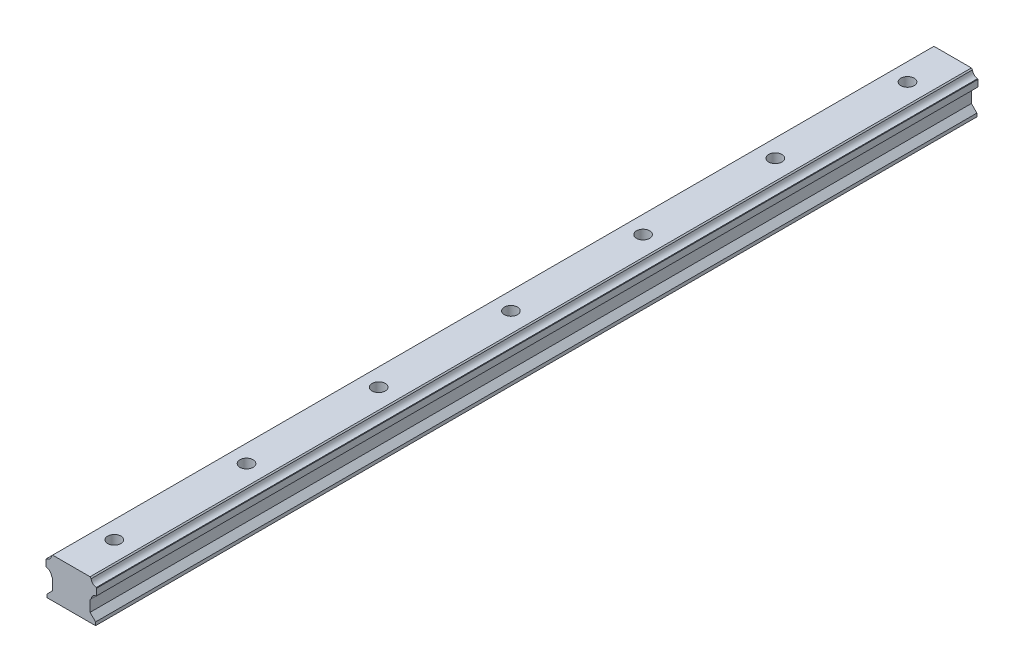
from build123d import *

# Parameters (mm, degrees)
ESTRUSIONE_ESTRUSIONE1_DEPTH      = 400
SCHIZZO2_R                        = 3
TAGLIO_ESTRUSIONE1_DEPTH          = 401.599824902
RIPETIZIONE_A_L1_COUNT            = 4
RIPETIZIONE_A_L1_PITCH            = 60
RIPETIZIONE_A_L2_COPY_1_SKETCH_R  = 3
RIPETIZIONE_A_L2_COPY_1_DEPTH     = 401.599824902
RIPETIZIONE_A_L2_COPY_2_SKETCH_R  = 3
RIPETIZIONE_A_L2_COPY_2_DEPTH     = 401.599824902
RIPETIZIONE_A_L2_COPY_3_SKETCH_R  = 3
RIPETIZIONE_A_L2_COPY_3_DEPTH     = 401.599824902
RIPETIZIONE_A_L2_COPY_4_SKETCH_R  = 3
RIPETIZIONE_A_L2_COPY_4_DEPTH     = 401.599824902
RIPETIZIONE_A_L2_COPY_5_SKETCH_R  = 3
RIPETIZIONE_A_L2_COPY_5_DEPTH     = 401.599824902
RIPETIZIONE_A_L2_COPY_6_SKETCH_R  = 3
RIPETIZIONE_A_L2_COPY_6_DEPTH     = 401.599824902
RIPETIZIONE_A_L2_COPY_7_SKETCH_R  = 3
RIPETIZIONE_A_L2_COPY_7_DEPTH     = 401.599824902
RIPETIZIONE_A_L2_COPY_8_SKETCH_R  = 3
RIPETIZIONE_A_L2_COPY_8_DEPTH     = 401.599824902
RIPETIZIONE_A_L2_COPY_9_SKETCH_R  = 3
RIPETIZIONE_A_L2_COPY_9_DEPTH     = 401.599824902
RIPETIZIONE_A_L2_COPY_10_SKETCH_R = 3
RIPETIZIONE_A_L2_COPY_10_DEPTH    = 401.599824902
RIPETIZIONE_A_L2_COPY_11_SKETCH_R = 3
RIPETIZIONE_A_L2_COPY_11_DEPTH    = 401.599824902
RIPETIZIONE_A_L2_COPY_12_SKETCH_R = 3
RIPETIZIONE_A_L2_COPY_12_DEPTH    = 401.599824902


with BuildPart() as part:
    # Schizzo1 → Estrusione-Estrusione1 (new body)
    with BuildSketch(Plane.XY):
        with BuildLine():
            Line((-10.001211602, -16.276222172), (-7.501211602, -13.776222172))
            Line((-7.501211602, -13.776222172), (-7.501211602, -8.776222172))
            Line((-7.501211602, -8.776222172), (-8.008796188, -8.268637585))
            ThreePointArc((-8.008796188, -8.268637585), (-8.733444649, -6.695460987), (-10.306621247, -5.970812526))
            Line((-10.306621247, -5.970812526), (-10.501211602, -5.776222172))
            Line((-10.501211602, -5.776222172), (-10.501211602, -2.776222172))
            Line((-10.501211602, -2.776222172), (-10.306621247, -2.581631817))
            ThreePointArc((-10.306621247, -2.581631817), (-8.733444649, -1.856983356), (-8.008796188, -0.283806758))
            Line((-8.008796188, -0.283806758), (-7.501211602, 0.223777828))
            Line((-7.501211602, 0.223777828), (9.498788398, 0.223777828))
            Line((9.498788398, 0.223777828), (10.006372984, -0.283806758))
            ThreePointArc((10.006372984, -0.283806758), (10.731021445, -1.856983356), (12.304198043, -2.581631817))
            Line((12.304198043, -2.581631817), (12.498788398, -2.776222172))
            Line((12.498788398, -2.776222172), (12.498788398, -5.776222172))
            Line((12.498788398, -5.776222172), (12.304198043, -5.970812526))
            ThreePointArc((12.304198043, -5.970812526), (10.731021445, -6.695460987), (10.006372984, -8.268637585))
            Line((10.006372984, -8.268637585), (9.498788398, -8.776222172))
            Line((9.498788398, -8.776222172), (9.498788398, -13.776222172))
            Line((9.498788398, -13.776222172), (11.998788398, -16.276222172))
            Line((11.998788398, -16.276222172), (11.998788398, -17.776222172))
            Line((11.998788398, -17.776222172), (-10.001211602, -17.776222172))
            Line((-10.001211602, -17.776222172), (-10.001211602, -16.276222172))
        make_face()
    extrude(amount=ESTRUSIONE_ESTRUSIONE1_DEPTH)

    # Schizzo2 → Taglio-Estrusione1 (cut, through all)
    with BuildSketch(Plane(origin=(0, 0.223777828, 0), x_dir=(1, 0, 0), z_dir=(0, 1, 0))):
        with Locations((0.499394199, -200)):
            Circle(SCHIZZO2_R)
    taglio_estrusione1 = extrude(amount=-TAGLIO_ESTRUSIONE1_DEPTH, mode=Mode.SUBTRACT)

    # Ripetizione a L1: Taglio-Estrusione1 ×4
    with Locations(*[(0, 0, i * RIPETIZIONE_A_L1_PITCH) for i in range(1, RIPETIZIONE_A_L1_COUNT)]):
        add(taglio_estrusione1, mode=Mode.SUBTRACT)

    # Ripetizione a L2 copy 1 sketch → Ripetizione a L2 copy 1 (cut, through all)
    with BuildSketch(Plane(origin=(0, 0.223777828, 0), x_dir=(1, 0, 0), z_dir=(0, 1, 0))):
        with Locations((0.499394199, -200)):
            Circle(RIPETIZIONE_A_L2_COPY_1_SKETCH_R)
    extrude(amount=-RIPETIZIONE_A_L2_COPY_1_DEPTH, mode=Mode.SUBTRACT)

    # Ripetizione a L2 copy 2 sketch → Ripetizione a L2 copy 2 (cut, through all)
    with BuildSketch(Plane(origin=(0, 0.223777828, -60), x_dir=(1, 0, 0), z_dir=(0, 1, 0))):
        with Locations((0.499394199, -200)):
            Circle(RIPETIZIONE_A_L2_COPY_2_SKETCH_R)
    extrude(amount=-RIPETIZIONE_A_L2_COPY_2_DEPTH, mode=Mode.SUBTRACT)

    # Ripetizione a L2 copy 3 sketch → Ripetizione a L2 copy 3 (cut, through all)
    with BuildSketch(Plane(origin=(0, 0.223777828, -120), x_dir=(1, 0, 0), z_dir=(0, 1, 0))):
        with Locations((0.499394199, -200)):
            Circle(RIPETIZIONE_A_L2_COPY_3_SKETCH_R)
    extrude(amount=-RIPETIZIONE_A_L2_COPY_3_DEPTH, mode=Mode.SUBTRACT)

    # Ripetizione a L2 copy 4 sketch → Ripetizione a L2 copy 4 (cut, through all)
    with BuildSketch(Plane(origin=(0, 0.223777828, 60), x_dir=(1, 0, 0), z_dir=(0, 1, 0))):
        with Locations((0.499394199, -200)):
            Circle(RIPETIZIONE_A_L2_COPY_4_SKETCH_R)
    extrude(amount=-RIPETIZIONE_A_L2_COPY_4_DEPTH, mode=Mode.SUBTRACT)

    # Ripetizione a L2 copy 5 sketch → Ripetizione a L2 copy 5 (cut, through all)
    with BuildSketch(Plane(origin=(0, 0.223777828, 0), x_dir=(1, 0, 0), z_dir=(0, 1, 0))):
        with Locations((0.499394199, -200)):
            Circle(RIPETIZIONE_A_L2_COPY_5_SKETCH_R)
    extrude(amount=-RIPETIZIONE_A_L2_COPY_5_DEPTH, mode=Mode.SUBTRACT)

    # Ripetizione a L2 copy 6 sketch → Ripetizione a L2 copy 6 (cut, through all)
    with BuildSketch(Plane(origin=(0, 0.223777828, -60), x_dir=(1, 0, 0), z_dir=(0, 1, 0))):
        with Locations((0.499394199, -200)):
            Circle(RIPETIZIONE_A_L2_COPY_6_SKETCH_R)
    extrude(amount=-RIPETIZIONE_A_L2_COPY_6_DEPTH, mode=Mode.SUBTRACT)

    # Ripetizione a L2 copy 7 sketch → Ripetizione a L2 copy 7 (cut, through all)
    with BuildSketch(Plane(origin=(0, 0.223777828, 120), x_dir=(1, 0, 0), z_dir=(0, 1, 0))):
        with Locations((0.499394199, -200)):
            Circle(RIPETIZIONE_A_L2_COPY_7_SKETCH_R)
    extrude(amount=-RIPETIZIONE_A_L2_COPY_7_DEPTH, mode=Mode.SUBTRACT)

    # Ripetizione a L2 copy 8 sketch → Ripetizione a L2 copy 8 (cut, through all)
    with BuildSketch(Plane(origin=(0, 0.223777828, 60), x_dir=(1, 0, 0), z_dir=(0, 1, 0))):
        with Locations((0.499394199, -200)):
            Circle(RIPETIZIONE_A_L2_COPY_8_SKETCH_R)
    extrude(amount=-RIPETIZIONE_A_L2_COPY_8_DEPTH, mode=Mode.SUBTRACT)

    # Ripetizione a L2 copy 9 sketch → Ripetizione a L2 copy 9 (cut, through all)
    with BuildSketch(Plane(origin=(0, 0.223777828, 0), x_dir=(1, 0, 0), z_dir=(0, 1, 0))):
        with Locations((0.499394199, -200)):
            Circle(RIPETIZIONE_A_L2_COPY_9_SKETCH_R)
    extrude(amount=-RIPETIZIONE_A_L2_COPY_9_DEPTH, mode=Mode.SUBTRACT)

    # Ripetizione a L2 copy 10 sketch → Ripetizione a L2 copy 10 (cut, through all)
    with BuildSketch(Plane(origin=(0, 0.223777828, -60), x_dir=(1, 0, 0), z_dir=(0, 1, 0))):
        with Locations((0.499394199, -200)):
            Circle(RIPETIZIONE_A_L2_COPY_10_SKETCH_R)
    extrude(amount=-RIPETIZIONE_A_L2_COPY_10_DEPTH, mode=Mode.SUBTRACT)

    # Ripetizione a L2 copy 11 sketch → Ripetizione a L2 copy 11 (cut, through all)
    with BuildSketch(Plane(origin=(0, 0.223777828, -120), x_dir=(1, 0, 0), z_dir=(0, 1, 0))):
        with Locations((0.499394199, -200)):
            Circle(RIPETIZIONE_A_L2_COPY_11_SKETCH_R)
    extrude(amount=-RIPETIZIONE_A_L2_COPY_11_DEPTH, mode=Mode.SUBTRACT)

    # Ripetizione a L2 copy 12 sketch → Ripetizione a L2 copy 12 (cut, through all)
    with BuildSketch(Plane(origin=(0, 0.223777828, -180), x_dir=(1, 0, 0), z_dir=(0, 1, 0))):
        with Locations((0.499394199, -200)):
            Circle(RIPETIZIONE_A_L2_COPY_12_SKETCH_R)
    extrude(amount=-RIPETIZIONE_A_L2_COPY_12_DEPTH, mode=Mode.SUBTRACT)


solid = part.part
